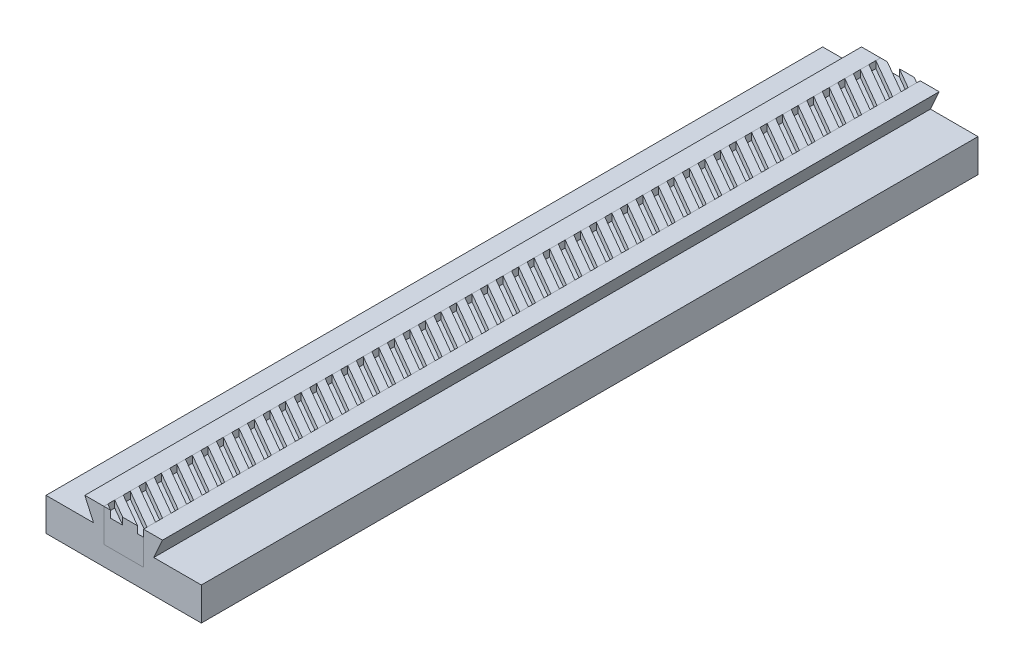
from build123d import *

# Parameters (mm, degrees)
EXTRUDE_1_DEPTH          = 200
CUT_EXTRUDE_1_DEPTH      = 202.450366095
CUT_EXTRUDE_1_DEPTH_BACK = 202.450366095
SKETCH_2_W               = 10.2
SKETCH_2_H               = 8.5
SKETCH_3_W               = 10.2
SKETCH_3_H               = 8.5
EXTRUDE_2_DEPTH          = 200
CUT_EXTRUDE_2_DEPTH      = 1.8
PATTERN_START            = 11.7
PATTERN_LINEAR_1_DEPTH   = 1.8
SKETCH_5_R               = 2
CUT_EXTRUDE_3_DEPTH      = 5


# Read off the part's stored shape, not the designer's step: 阵列(线性)1
with BuildPart() as part:
    # 草图1 → 凸台-拉伸1 (new body)
    with BuildSketch(Plane.XY):
        Polygon((20, 0), (-20, 0), (-20, 8.5), (-7.75, 8.5), (-10, 13.5), (10, 13.5), (7.75, 8.5), (20, 8.5), align=None)
    extrude(amount=EXTRUDE_1_DEPTH)

    # 草图2 → 切除-拉伸1 (cut, two sides: drawn at the far end of the back side and taken through both)
    with BuildSketch(Plane.XY.offset(200).offset(-CUT_EXTRUDE_1_DEPTH_BACK)):
        with Locations((0, 9.25)):
            Rectangle(SKETCH_2_W, SKETCH_2_H)
    extrude(amount=CUT_EXTRUDE_1_DEPTH + CUT_EXTRUDE_1_DEPTH_BACK, mode=Mode.SUBTRACT)

    # 草图5 → 切除-拉伸3 (cut)
    with BuildSketch(Plane.XZ):
        with Locations(Location((-16, 100, 0), (0, 0, 270))):
            Circle(SKETCH_5_R)
        with Locations(Location((16, 100, 0), (0, 0, 90))):
            Circle(SKETCH_5_R)
        with Locations(Location((-16, 175, 0), (0, 0, 270))):
            Circle(SKETCH_5_R)
        with Locations(Location((16, 175, 0), (0, 0, 90))):
            Circle(SKETCH_5_R)
        with Locations(Location((16, 25, 0), (0, 0, 90))):
            Circle(SKETCH_5_R)
        with Locations(Location((-16, 25, 0), (0, 0, 270))):
            Circle(SKETCH_5_R)
    extrude(amount=-CUT_EXTRUDE_3_DEPTH, mode=Mode.SUBTRACT)


with BuildPart() as body_2:
    # 草图3 → 凸台-拉伸2 (new body)
    with BuildSketch(Plane(origin=(0, 0, 0), x_dir=(-1, 0, 0), z_dir=(0, 0, -1))):
        with Locations((0, 9.25)):
            Rectangle(SKETCH_3_W, SKETCH_3_H)
    extrude(amount=-EXTRUDE_2_DEPTH)

    # 草图4 → 切除-拉伸2 (cut)
    with BuildSketch(Plane(origin=(0, 13.5, 0), x_dir=(1, 0, 0), z_dir=(0, 1, 0))):
        Polygon((-5.1, 6.8), (5.1, 0.911027254), (5.1, -0.888972746), (-5.1, 5), align=None)
    extrude(amount=-CUT_EXTRUDE_2_DEPTH, mode=Mode.SUBTRACT)

    # 阵列(线性)1 outline → 阵列(线性)1 (cut)
    with BuildSketch(Plane(origin=(0, 0, 0), x_dir=(1, 0, 0), z_dir=(0, 1, 0)).offset(PATTERN_START)):
        Polygon((5.1, -4.888972746), (5.1, -3.088972746), (-0.250257739, 0), (-3.367949192, 0), align=None)
        Polygon((5.1, -8.888972746), (5.1, -7.088972746), (-5.1, -1.2), (-5.1, -3), align=None)
        Polygon((5.1, -12.888972746), (5.1, -11.088972746), (-5.1, -5.2), (-5.1, -7), align=None)
        Polygon((5.1, -16.888972746), (5.1, -15.088972746), (-5.1, -9.2), (-5.1, -11), align=None)
        Polygon((5.1, -20.888972746), (5.1, -19.088972746), (-5.1, -13.2), (-5.1, -15), align=None)
        Polygon((5.1, -24.888972746), (5.1, -23.088972746), (-5.1, -17.2), (-5.1, -19), align=None)
        Polygon((5.1, -28.888972746), (5.1, -27.088972746), (-5.1, -21.2), (-5.1, -23), align=None)
        Polygon((5.1, -32.888972746), (5.1, -31.088972746), (-5.1, -25.2), (-5.1, -27), align=None)
        Polygon((5.1, -36.888972746), (5.1, -35.088972746), (-5.1, -29.2), (-5.1, -31), align=None)
        Polygon((5.1, -40.888972746), (5.1, -39.088972746), (-5.1, -33.2), (-5.1, -35), align=None)
        Polygon((5.1, -44.888972746), (5.1, -43.088972746), (-5.1, -37.2), (-5.1, -39), align=None)
        Polygon((5.1, -48.888972746), (5.1, -47.088972746), (-5.1, -41.2), (-5.1, -43), align=None)
        Polygon((5.1, -52.888972746), (5.1, -51.088972746), (-5.1, -45.2), (-5.1, -47), align=None)
        Polygon((5.1, -56.888972746), (5.1, -55.088972746), (-5.1, -49.2), (-5.1, -51), align=None)
        Polygon((5.1, -60.888972746), (5.1, -59.088972746), (-5.1, -53.2), (-5.1, -55), align=None)
        Polygon((5.1, -64.888972746), (5.1, -63.088972746), (-5.1, -57.2), (-5.1, -59), align=None)
        Polygon((5.1, -68.888972746), (5.1, -67.088972746), (-5.1, -61.2), (-5.1, -63), align=None)
        Polygon((5.1, -72.888972746), (5.1, -71.088972746), (-5.1, -65.2), (-5.1, -67), align=None)
        Polygon((5.1, -76.888972746), (5.1, -75.088972746), (-5.1, -69.2), (-5.1, -71), align=None)
        Polygon((5.1, -80.888972746), (5.1, -79.088972746), (-5.1, -73.2), (-5.1, -75), align=None)
        Polygon((5.1, -84.888972746), (5.1, -83.088972746), (-5.1, -77.2), (-5.1, -79), align=None)
        Polygon((5.1, -88.888972746), (5.1, -87.088972746), (-5.1, -81.2), (-5.1, -83), align=None)
        Polygon((5.1, -92.888972746), (5.1, -91.088972746), (-5.1, -85.2), (-5.1, -87), align=None)
        Polygon((5.1, -96.888972746), (5.1, -95.088972746), (-5.1, -89.2), (-5.1, -91), align=None)
        Polygon((5.1, -100.888972746), (5.1, -99.088972746), (-5.1, -93.2), (-5.1, -95), align=None)
        Polygon((5.1, -104.888972746), (5.1, -103.088972746), (-5.1, -97.2), (-5.1, -99), align=None)
        Polygon((5.1, -108.888972746), (5.1, -107.088972746), (-5.1, -101.2), (-5.1, -103), align=None)
        Polygon((5.1, -112.888972746), (5.1, -111.088972746), (-5.1, -105.2), (-5.1, -107), align=None)
        Polygon((5.1, -116.888972746), (5.1, -115.088972746), (-5.1, -109.2), (-5.1, -111), align=None)
        Polygon((5.1, -120.888972746), (5.1, -119.088972746), (-5.1, -113.2), (-5.1, -115), align=None)
        Polygon((5.1, -124.888972746), (5.1, -123.088972746), (-5.1, -117.2), (-5.1, -119), align=None)
        Polygon((5.1, -128.888972746), (5.1, -127.088972746), (-5.1, -121.2), (-5.1, -123), align=None)
        Polygon((5.1, -132.888972746), (5.1, -131.088972746), (-5.1, -125.2), (-5.1, -127), align=None)
        Polygon((5.1, -136.888972746), (5.1, -135.088972746), (-5.1, -129.2), (-5.1, -131), align=None)
        Polygon((5.1, -140.888972746), (5.1, -139.088972746), (-5.1, -133.2), (-5.1, -135), align=None)
        Polygon((5.1, -144.888972746), (5.1, -143.088972746), (-5.1, -137.2), (-5.1, -139), align=None)
        Polygon((5.1, -148.888972746), (5.1, -147.088972746), (-5.1, -141.2), (-5.1, -143), align=None)
        Polygon((5.1, -152.888972746), (5.1, -151.088972746), (-5.1, -145.2), (-5.1, -147), align=None)
        Polygon((5.1, -156.888972746), (5.1, -155.088972746), (-5.1, -149.2), (-5.1, -151), align=None)
        Polygon((5.1, -160.888972746), (5.1, -159.088972746), (-5.1, -153.2), (-5.1, -155), align=None)
        Polygon((5.1, -164.888972746), (5.1, -163.088972746), (-5.1, -157.2), (-5.1, -159), align=None)
        Polygon((5.1, -168.888972746), (5.1, -167.088972746), (-5.1, -161.2), (-5.1, -163), align=None)
        Polygon((5.1, -172.888972746), (5.1, -171.088972746), (-5.1, -165.2), (-5.1, -167), align=None)
        Polygon((5.1, -176.888972746), (5.1, -175.088972746), (-5.1, -169.2), (-5.1, -171), align=None)
        Polygon((5.1, -180.888972746), (5.1, -179.088972746), (-5.1, -173.2), (-5.1, -175), align=None)
        Polygon((5.1, -184.888972746), (5.1, -183.088972746), (-5.1, -177.2), (-5.1, -179), align=None)
        Polygon((5.1, -188.888972746), (5.1, -187.088972746), (-5.1, -181.2), (-5.1, -183), align=None)
        Polygon((5.1, -192.888972746), (5.1, -191.088972746), (-5.1, -185.2), (-5.1, -187), align=None)
        Polygon((5.1, -196.888972746), (5.1, -195.088972746), (-5.1, -189.2), (-5.1, -191), align=None)
        Polygon((5.1, -200), (5.1, -199.088972746), (-5.1, -193.2), (-5.1, -195), (3.560254038, -200), align=None)
        Polygon((-0.250257739, -200), (-5.1, -197.2), (-5.1, -199), (-3.367949192, -200), align=None)
    extrude(amount=PATTERN_LINEAR_1_DEPTH, mode=Mode.SUBTRACT)


solid = Compound([part.part, body_2.part])
